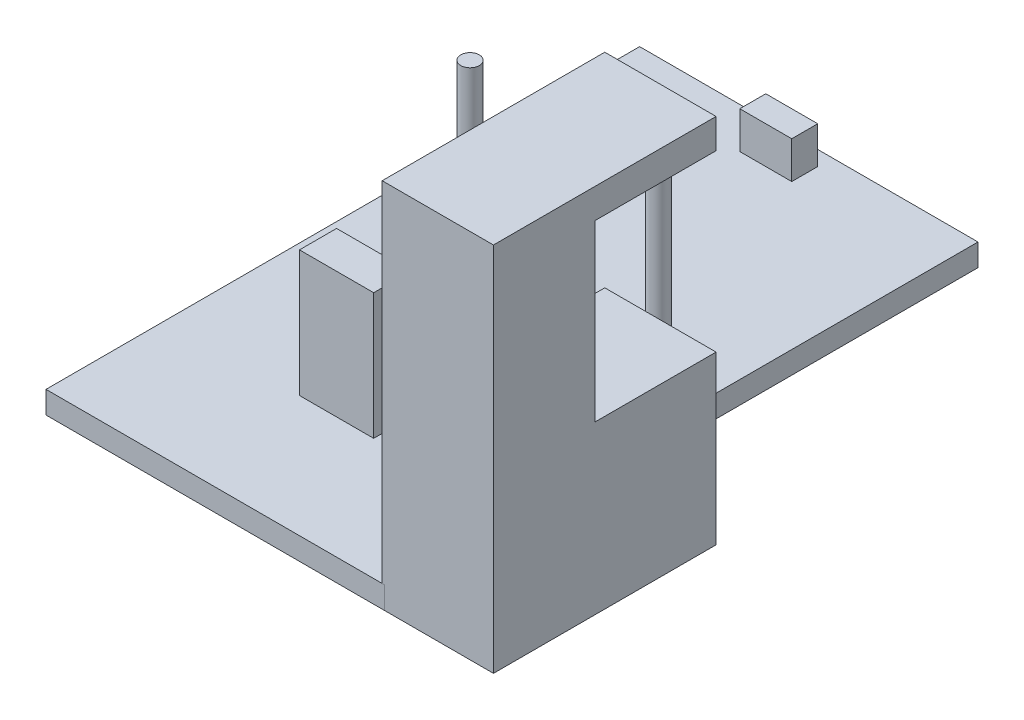
from build123d import *

# Parameters (mm, degrees)
SKETCH5_W           = 45.6
SKETCH5_H           = 80
BOSS_EXTRUDE4_DEPTH = 3
SKETCH6_W           = 7
SKETCH6_H           = 3.5
BOSS_EXTRUDE5_DEPTH = 5
BOSS_EXTRUDE7_DEPTH = 50
SKETCH10_W          = 15.160141762
SKETCH10_H          = 23.5
CUT_EXTRUDE1_DEPTH  = 16.34
SKETCH12_R          = 1
CUT_EXTRUDE3_DEPTH  = 5
SKETCH13_R          = 1.25
BOSS_EXTRUDE8_DEPTH = 20
SKETCH14_W          = 10
SKETCH14_H          = 5
BOSS_EXTRUDE9_DEPTH = 17


with BuildPart() as part:
    # Sketch5 → Boss-Extrude4 (new body)
    with BuildSketch(Plane(origin=(0, 0, 0), x_dir=(1, 0, 0), z_dir=(0, 1, 0))):
        Rectangle(SKETCH5_W, SKETCH5_H)
    extrude(amount=BOSS_EXTRUDE4_DEPTH)

    # Sketch6 → Boss-Extrude5 (add)
    with BuildSketch(Plane(origin=(0, 3, 0), x_dir=(1, 0, 0), z_dir=(0, 1, 0))):
        with Locations((-0.3, 36.25)):
            Rectangle(SKETCH6_W, SKETCH6_H)
    extrude(amount=BOSS_EXTRUDE5_DEPTH)

    # Sketch9 → Boss-Extrude7 (add)
    with BuildSketch(Plane(origin=(0, 0, 0), x_dir=(1, 0, 0), z_dir=(0, 1, 0))):
        Polygon((22.5, -39.999100024), (37.5, -39.999100024), (37.5, -9.999100024), (22.5000054, -9.999100024), align=None)
    extrude(amount=BOSS_EXTRUDE7_DEPTH)

    # Sketch10 → Cut-Extrude1 (cut)
    with BuildSketch(Plane(origin=(0, 0, 9.999100024), x_dir=(-1, 0, 0), z_dir=(0, 0, -1))):
        with Locations((-30, 34.25)):
            Rectangle(SKETCH10_W, SKETCH10_H)
    extrude(amount=-CUT_EXTRUDE1_DEPTH, mode=Mode.SUBTRACT)

    # Sketch12 → Cut-Extrude3 (cut)
    with BuildSketch(Plane(origin=(0, 0, 9.999100024), x_dir=(-1, 0, 0), z_dir=(0, 0, -1))):
        with Locations((-30.0000027, 48.21)):
            Circle(SKETCH12_R)
    extrude(amount=-CUT_EXTRUDE3_DEPTH, mode=Mode.SUBTRACT)

    # Sketch13 → Boss-Extrude8 (add)
    with BuildSketch(Plane(origin=(0, 3, 0), x_dir=(1, 0, 0), z_dir=(0, 1, 0))):
        with Locations((-12.64, 6.99)):
            Circle(SKETCH13_R)
        with Locations((12.76, 6.99)):
            Circle(SKETCH13_R)
    extrude(amount=BOSS_EXTRUDE8_DEPTH)

    # Sketch14 → Boss-Extrude9 (add)
    with BuildSketch(Plane(origin=(0, 3, 0), x_dir=(1, 0, 0), z_dir=(0, 1, 0))):
        with Locations((0, -21.139741123)):
            Rectangle(SKETCH14_W, SKETCH14_H)
    extrude(amount=BOSS_EXTRUDE9_DEPTH)


solid = part.part
